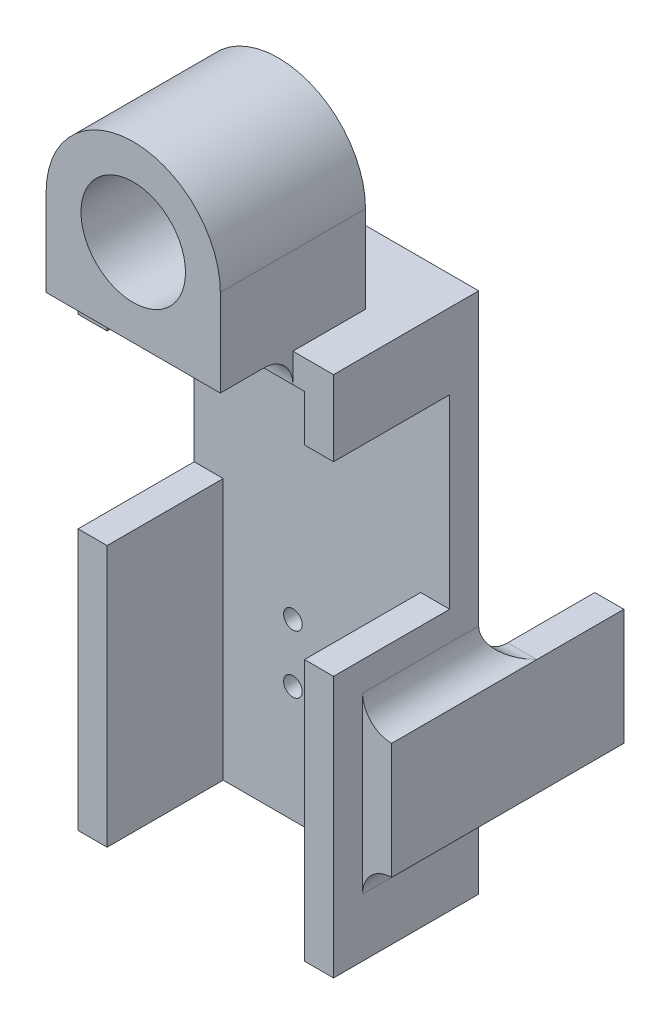
from build123d import *

# Parameters (mm, degrees)
SKETCH_1_W          = 44
SKETCH_1_H          = 90
EXTRUDE_1_DEPTH     = 25
CUT_EXTRUDE_1_DEPTH = 20
SKETCH_3_W          = 5
SKETCH_3_H          = 20
EXTRUDE_2_DEPTH     = 20
FILLET_1_R          = 5
FILLET_START        = -22.5281
FILLET_3_DEPTH      = 0.5281
FILLET_START_2      = 22
FILLET_3_2_DEPTH    = 0.5137
FILLET_START_3      = 22.5137
FILLET_3_3_DEPTH    = 4.4863
FILLET_START_4      = -27
FILLET_3_4_DEPTH    = 4.4719
FILLET_START_5      = -20
FILLET_3_5_DEPTH    = 20
SKETCH_4_W          = 30
SKETCH_4_H          = 25
EXTRUDE_3_DEPTH     = 15
SKETCH_5_R          = 15
EXTRUDE_4_DEPTH     = 25
SKETCH_6_R          = 9
CUT_EXTRUDE_2_DEPTH = 25
FILLET_4_R          = 5
SKETCH_7_W          = 76.334334434
SKETCH_7_H          = 32
CUT_EXTRUDE_3_DEPTH = 20
SKETCH_9_W          = 10
SKETCH_9_H          = 40
CUT_EXTRUDE_5_DEPTH = 5
SKETCH_10_R         = 1.6
CUT_EXTRUDE_6_DEPTH = 5


with BuildPart() as part:
    # 草图1 → 凸台-拉伸1 (new body)
    with BuildSketch(Plane.XY):
        Rectangle(SKETCH_1_W, SKETCH_1_H)
    extrude(amount=EXTRUDE_1_DEPTH)

    # 草图2 → 切除-拉伸1 (cut)
    with BuildSketch(Plane.XY.offset(25)):
        Polygon((-17, 40), (17, 40), (17, -40), (17, -54.466657213), (-17, -54.466657213), (-17, -40), align=None)
    extrude(amount=-CUT_EXTRUDE_1_DEPTH, mode=Mode.SUBTRACT)

    # 草图3 → 凸台-拉伸2 (add, symmetric)
    with BuildSketch(Plane(origin=(0, 0, 0), x_dir=(-1, 0, 0), z_dir=(0, 0, -1))):
        with Locations((24.5, -20)):
            Rectangle(SKETCH_3_W, SKETCH_3_H)
        with Locations((-24.5, -20)):
            Rectangle(SKETCH_3_W, SKETCH_3_H)
    extrude(amount=EXTRUDE_2_DEPTH, both=True)

    # 圆角1
    fillet_1_edges = [part.edges().sort_by_distance(p)[0] for p in [
        (22, -30, 10),
        (-22, -30, 10),
        (-22, -10, 10),
        (22, -10, 10),
    ]]
    fillet(fillet_1_edges, radius=FILLET_1_R - 0.0001)  # a hair under: the kernel refuses the full size

    # 圆角3: read off the stored shape, not the designer's step
    # 圆角3 outline → 圆角3 (add)
    with BuildSketch(Plane.YZ.offset(FILLET_START)):
        with BuildLine():
            Line((-5, 0), (-10, 0))
            Line((-10, 0), (-10, -5))
            ThreePointArc((-10, -5), (-8.535533906, -1.464466094), (-5, 0))
        make_face()
        with BuildLine():
            ThreePointArc((-35, 0), (-31.464466094, -1.464466094), (-30, -5))
            Line((-30, -5), (-30, 0))
            Line((-30, 0), (-35, 0))
        make_face()
    extrude(amount=FILLET_3_DEPTH)

    # Fillet 3 2 outline → Fillet 3 2 (add)
    with BuildSketch(Plane.YZ.offset(FILLET_START_2)):
        with BuildLine():
            Line((-5, 0), (-10, 0))
            Line((-10, 0), (-10, -5))
            ThreePointArc((-10, -5), (-8.535533906, -1.464466094), (-5, 0))
        make_face()
        with BuildLine():
            ThreePointArc((-35, 0), (-31.464466094, -1.464466094), (-30, -5))
            Line((-30, -5), (-30, 0))
            Line((-30, 0), (-35, 0))
        make_face()
    extrude(amount=FILLET_3_2_DEPTH)

    # Fillet 3 3 outline → Fillet 3 3 (add)
    with BuildSketch(Plane.YZ.offset(FILLET_START_3)):
        with BuildLine():
            ThreePointArc((-35, 0), (-31.464466094, -1.464466094), (-30, -5))
            Line((-30, -5), (-30, 0))
            Line((-30, 0), (-35, 0))
        make_face()
        with BuildLine():
            Line((-10, 0), (-10, -5))
            ThreePointArc((-10, -5), (-8.535533906, -1.464466094), (-5, 0))
            Line((-5, 0), (-10, 0))
        make_face()
    extrude(amount=FILLET_3_3_DEPTH)

    # Fillet 3 4 outline → Fillet 3 4 (add)
    with BuildSketch(Plane.YZ.offset(FILLET_START_4)):
        with BuildLine():
            ThreePointArc((-35, 0), (-31.464466094, -1.464466094), (-30, -5))
            Line((-30, -5), (-30, 0))
            Line((-30, 0), (-35, 0))
        make_face()
        with BuildLine():
            Line((-10, 0), (-10, -5))
            ThreePointArc((-10, -5), (-8.535533906, -1.464466094), (-5, 0))
            Line((-5, 0), (-10, 0))
        make_face()
    extrude(amount=FILLET_3_4_DEPTH)

    # Fillet 3 5 outline → Fillet 3 5 (cut)
    with BuildSketch(Plane.XY.offset(FILLET_START_5)):
        with BuildLine():
            ThreePointArc((27, -30), (23.464466094, -31.464466094), (22, -35))
            Line((22, -35), (22, -36))
            Line((22, -36), (27, -36))
            Line((27, -36), (27, -30))
        make_face()
        with BuildLine():
            ThreePointArc((22, -5), (23.464466094, -8.535533906), (27, -10))
            Line((27, -10), (27, -3))
            Line((27, -3), (22, -3))
            Line((22, -3), (22, -5))
        make_face()
        with BuildLine():
            Line((-27, -36), (-22, -36))
            Line((-22, -36), (-22, -35))
            ThreePointArc((-22, -35), (-23.464466094, -31.464466094), (-27, -30))
            Line((-27, -30), (-27, -36))
        make_face()
        with BuildLine():
            Line((-22, -5), (-22, -3))
            Line((-22, -3), (-27, -3))
            Line((-27, -3), (-27, -10))
            ThreePointArc((-27, -10), (-23.464466094, -8.535533906), (-22, -5))
        make_face()
    extrude(amount=FILLET_3_5_DEPTH, mode=Mode.SUBTRACT)

    # 草图4 → 凸台-拉伸3 (add)
    with BuildSketch(Plane(origin=(0, 45, 0), x_dir=(1, 0, 0), z_dir=(0, 1, 0))):
        with Locations((0, -25)):
            Rectangle(SKETCH_4_W, SKETCH_4_H)
    extrude(amount=EXTRUDE_3_DEPTH)

    # 草图5 → 凸台-拉伸4 (add)
    with BuildSketch(Plane.XY.offset(37.5)):
        with Locations((0, 60)):
            Circle(SKETCH_5_R)
    extrude(amount=-EXTRUDE_4_DEPTH)

    # 草图6 → 切除-拉伸2 (cut)
    with BuildSketch(Plane.XY.offset(37.5)):
        with Locations((0, 60)):
            Circle(SKETCH_6_R)
    extrude(amount=-CUT_EXTRUDE_2_DEPTH, mode=Mode.SUBTRACT)

    # 圆角4
    fillet_4_edges = [part.edges().sort_by_distance(p)[0] for p in [
        (0, 45, 25),
    ]]
    fillet(fillet_4_edges, radius=FILLET_4_R - 0.0001)  # a hair under: the kernel refuses the full size

    # 草图7 → 切除-拉伸3 (cut)
    with BuildSketch(Plane.XY.offset(25)):
        with Locations((0, 16)):
            Rectangle(SKETCH_7_W, SKETCH_7_H)
    extrude(amount=-CUT_EXTRUDE_3_DEPTH, mode=Mode.SUBTRACT)

    # 草图9 → 切除-拉伸5 (cut)
    with BuildSketch(Plane(origin=(0, 0, -20), x_dir=(-1, 0, 0), z_dir=(0, 0, -1))):
        with Locations((22, -10)):
            Rectangle(SKETCH_9_W, SKETCH_9_H)
    extrude(amount=-CUT_EXTRUDE_5_DEPTH, mode=Mode.SUBTRACT)

    # 草图10 → 切除-拉伸6 (cut)
    with BuildSketch(Plane(origin=(0, 0, 0), x_dir=(-1, 0, 0), z_dir=(0, 0, -1))):
        with Locations((5, -15)):
            Circle(SKETCH_10_R)
        with Locations((5, -25)):
            Circle(SKETCH_10_R)
        with Locations((-5, -25)):
            Circle(SKETCH_10_R)
        with Locations((-5, -15)):
            Circle(SKETCH_10_R)
    extrude(amount=-CUT_EXTRUDE_6_DEPTH, mode=Mode.SUBTRACT)


solid = part.part
